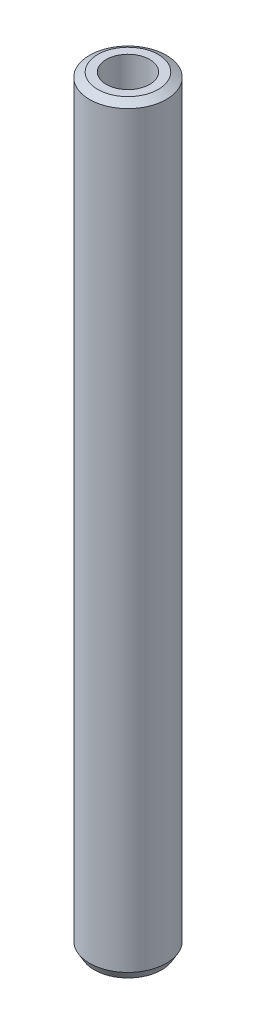
from build123d import *
from OCP.BRepFilletAPI import BRepFilletAPI_MakeChamfer

# Parameters (mm, degrees)
SKETCH1_R           = 27.5
BOSS_EXTRUDE1_DEPTH = 545.21398901
SKETCH2_R           = 15.535368916
CUT_EXTRUDE1_DEPTH  = 547.599299133
CHAMFER1_SIZE       = 3.349578046
CHAMFER1_SIZE2      = 5.80163936


with BuildPart() as part:
    # Sketch1 → Boss-Extrude1 (new body)
    with BuildSketch(Plane(origin=(0, 0, 0), x_dir=(1, 0, 0), z_dir=(0, 1, 0))):
        Circle(SKETCH1_R)
    extrude(amount=BOSS_EXTRUDE1_DEPTH)

    # Sketch2 → Cut-Extrude1 (cut, through all)
    with BuildSketch(Plane(origin=(0, 0, 0), x_dir=(1, 0, 0), z_dir=(0, 1, 0))):
        Circle(SKETCH2_R)
    extrude(amount=CUT_EXTRUDE1_DEPTH, mode=Mode.SUBTRACT)

    # Chamfer1: one chamfer whose edges measure the first distance from different faces: ONE call of the kernel's chamfer builder (chamfer() names one face for all edges)
    chamfer1_edges_1 = [part.edges().sort_by_distance(p)[0] for p in [
        (-27.5, 545.21398901, 0),
    ]]
    chamfer1_side_1 = [part.faces().sort_by_distance(p)[0] for p in [
        (-27.5, 272.606994505, 0),
    ]]
    chamfer1_edges_2 = [part.edges().sort_by_distance(p)[0] for p in [
        (-27.5, 0, 0),
    ]]
    chamfer1_side_2 = [part.faces().sort_by_distance(p)[0] for p in [
        (-26.722182541, 0, 0),
    ]]
    chamfer1 = BRepFilletAPI_MakeChamfer(part.part.solid().wrapped)
    for e in chamfer1_edges_1:
        chamfer1.Add(CHAMFER1_SIZE, CHAMFER1_SIZE2, e.wrapped, chamfer1_side_1[0].wrapped)  # the first distance lies on this face
    for e in chamfer1_edges_2:
        chamfer1.Add(CHAMFER1_SIZE, CHAMFER1_SIZE2, e.wrapped, chamfer1_side_2[0].wrapped)  # the first distance lies on this face
    add(Compound.cast(chamfer1.Shape()), mode=Mode.REPLACE)


solid = part.part
